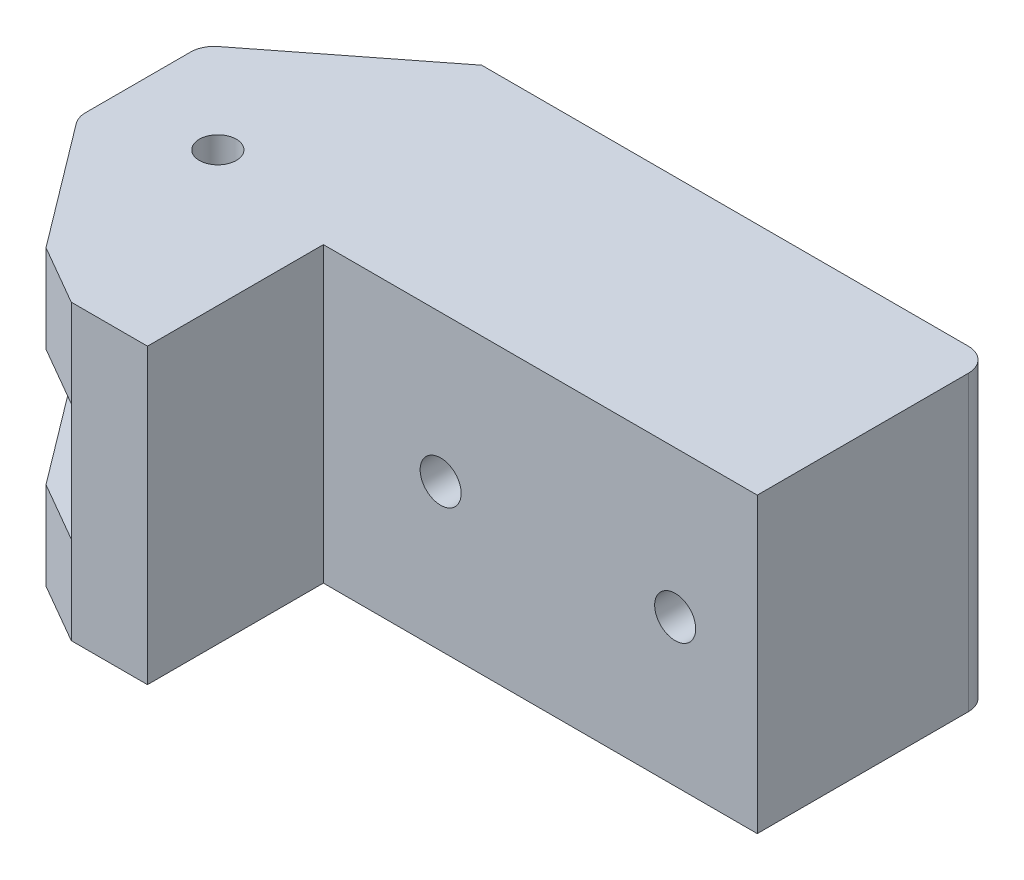
from build123d import *

# Parameters (mm, degrees)
SKETCH1_R           = 1.575
BOSS_EXTRUDE1_DEPTH = 12.5
SKETCH2_W           = 13.385271969
SKETCH2_H           = 10
CUT_EXTRUDE1_DEPTH  = 68.949865099
SKETCH3_R           = 1.75
CUT_EXTRUDE2_DEPTH  = 25
SKETCH4_R           = 4
CUT_EXTRUDE3_DEPTH  = 4
FILLET1_R           = 2


with BuildPart() as part:
    # Sketch1 → Boss-Extrude1 (new, symmetric)
    with BuildSketch(Plane(origin=(0, 0, 0), x_dir=(1, 0, 0), z_dir=(0, 1, 0))):
        Polygon((0, 0), (-43.5, 0), (-56.885271969, -10.457720596), (-56.885271969, -21.057720596), (-48.596177418, -32.057720596), (-43.5, -35), (-37, -35), (-37, -20), (0, -20), align=None)
        with Locations((-48.5, -17.5)):
            Circle(SKETCH1_R, mode=Mode.SUBTRACT)
    extrude(amount=BOSS_EXTRUDE1_DEPTH, both=True)

    # Sketch2 → Cut-Extrude1 (cut, through all)
    with BuildSketch(Plane.XY.offset(35)):
        with Locations((-50.192635985, 0)):
            Rectangle(SKETCH2_W, SKETCH2_H)
    extrude(amount=-CUT_EXTRUDE1_DEPTH, mode=Mode.SUBTRACT)

    # Sketch3 → Cut-Extrude2 (cut)
    with BuildSketch(Plane.XY.offset(20)):
        with Locations((-27, 0)):
            Circle(SKETCH3_R)
        with Locations((-7, 0)):
            Circle(SKETCH3_R)
    extrude(amount=-CUT_EXTRUDE2_DEPTH, mode=Mode.SUBTRACT)

    # Sketch4 → Cut-Extrude3 (cut)
    with BuildSketch(Plane(origin=(0, 0, 0), x_dir=(-1, 0, 0), z_dir=(0, 0, -1))):
        with Locations((7, 0)):
            Circle(SKETCH4_R)
        with Locations((27, 0)):
            Circle(SKETCH4_R)
    extrude(amount=-CUT_EXTRUDE3_DEPTH, mode=Mode.SUBTRACT)

    # Fillet1
    fillet1_edges = [part.edges().sort_by_distance(p)[0] for p in [
        (0, 0, 0),
        (-56.885271969, 8.75, 10.457720596),
        (-56.885271969, 8.75, 21.057720596),
        (-56.885271969, -8.75, 21.057720596),
        (-56.885271969, -8.75, 10.457720596),
    ]]
    fillet(fillet1_edges, radius=FILLET1_R)


solid = part.part
